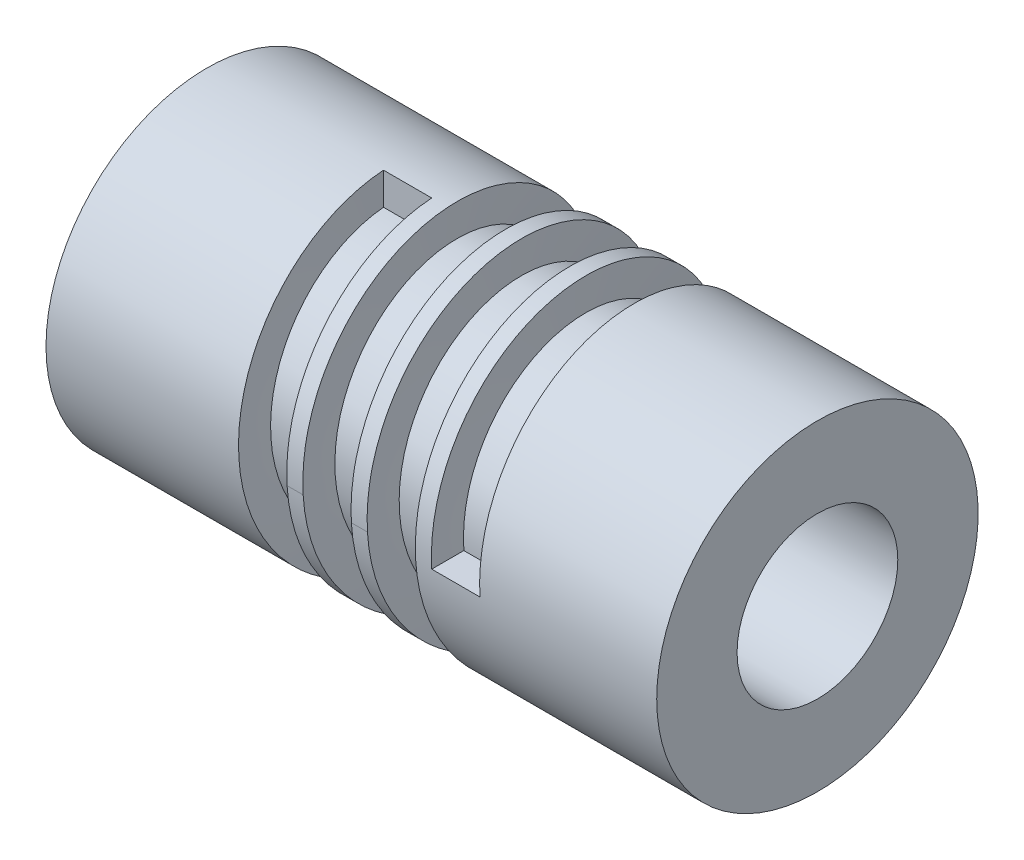
from build123d import *

# Parameters (mm, degrees)
CUT_SWEEP1_PITCH = 4


with BuildPart() as part:
    # Sketch1 → Revolve1 (revolve)
    with BuildSketch(Plane.XY, mode=Mode.PRIVATE) as revolve1_sk:
        Polygon((7.495497647, 5), (7.495497647, 10), (-30.504502353, 10), (-30.504502353, 2.5), (-20.504502353, 2.5), (-20.504502353, 0), (-2.504502353, 0), (-2.504502353, 5), align=None)
    revolve(revolve1_sk.sketch.rotate(Axis((-30.504502353, 0, 0), (1, 0, 0)), 90), axis=Axis((-30.504502353, 0, 0), (1, 0, 0)))

    # Cut-Sweep1: arcs per turn and ends read off the stored shape
    # Cut-Sweep1: the profile of Sketch2 profile screwed along a right-hand helix through 3.25 turns, 12 arcs to a turn; built about Z, then put on its axis
    cut_sweep1_z = Axis((0, 0, 0), (0, 0, 1))
    cut_sweep1_corners = [(10.0003, 3.1417e-05, -7.495495647), (10.0003, 3.1417e-05, -10.495495647), (8, 2.5133e-05, -10.495495647), (8, 2.5133e-05, -7.495495647)]
    with BuildLine(mode=Mode.PRIVATE) as cut_sweep1_profile:
        Line(cut_sweep1_corners[0], cut_sweep1_corners[1])
        Line(cut_sweep1_corners[1], cut_sweep1_corners[2])
        Line(cut_sweep1_corners[2], cut_sweep1_corners[3])
        Line(cut_sweep1_corners[3], cut_sweep1_corners[0])
    cut_sweep1_cap = Face(cut_sweep1_profile.wire())
    cut_sweep1_turn_angles = [0, 15, 30, 45, 60, 75, 90, 105, 120, 135, 150, 165, 180, 195, 210, 225, 240, 255, 270, 285, 300, 315, 330, 345, 360]
    cut_sweep1_turn_weights = [1, 0.9659258262890683, 1, 0.9659258262890683, 1, 0.9659258262890683, 1, 0.9659258262890683, 1, 0.9659258262890683, 1, 0.9659258262890683, 1, 0.9659258262890683, 1, 0.9659258262890683, 1, 0.9659258262890683, 1, 0.9659258262890683, 1, 0.9659258262890683, 1, 0.9659258262890683, 1]
    cut_sweep1_turn_rails = [Edge.make_bspline([Vector(p[0], p[1], 0).rotate(cut_sweep1_z, cut_sweep1_turn_angles[k]) / cut_sweep1_turn_weights[k] + Vector(0, 0, p[2] + CUT_SWEEP1_PITCH * cut_sweep1_turn_angles[k] / 360) for k in range(25)], [0, 0, 0, 1, 1, 2, 2, 3, 3, 4, 4, 5, 5, 6, 6, 7, 7, 8, 8, 9, 9, 10, 10, 11, 11, 12, 12, 12], 2, cut_sweep1_turn_weights) for p in cut_sweep1_corners]
    cut_sweep1_turn_sides = [Face.make_surface_from_curves(cut_sweep1_turn_rails[p[0]], cut_sweep1_turn_rails[p[1]]) for p in [(0, 1), (1, 2), (2, 3), (3, 0)]]
    cut_sweep1_last_angles = [1080, 1095, 1110, 1125, 1140, 1155, 1170]
    cut_sweep1_last_weights = [1, 0.9659258262890683, 1, 0.9659258262890683, 1, 0.9659258262890646, 1]
    cut_sweep1_last_rails = [Edge.make_bspline([Vector(p[0], p[1], 0).rotate(cut_sweep1_z, cut_sweep1_last_angles[k]) / cut_sweep1_last_weights[k] + Vector(0, 0, p[2] + CUT_SWEEP1_PITCH * cut_sweep1_last_angles[k] / 360) for k in range(7)], [0, 0, 0, 1, 1, 2, 2, 3, 3, 3], 2, cut_sweep1_last_weights) for p in cut_sweep1_corners]
    cut_sweep1_last_sides = [Face.make_surface_from_curves(cut_sweep1_last_rails[p[0]], cut_sweep1_last_rails[p[1]]) for p in [(0, 1), (1, 2), (2, 3), (3, 0)]]
    cut_sweep1 = Plane(origin=(-14, 0, 0), x_dir=(0, 0, 1), z_dir=(-1, 0, 0)) * Solid(Shell([*[p.moved(Location((0, 0, CUT_SWEEP1_PITCH * i))) for i in range(3) for p in cut_sweep1_turn_sides], *cut_sweep1_last_sides, cut_sweep1_cap, cut_sweep1_cap.rotate(cut_sweep1_z, 1170).moved(Location((0, 0, CUT_SWEEP1_PITCH * 1170 / 360)))]))
    add(cut_sweep1, mode=Mode.SUBTRACT)


solid = part.part
